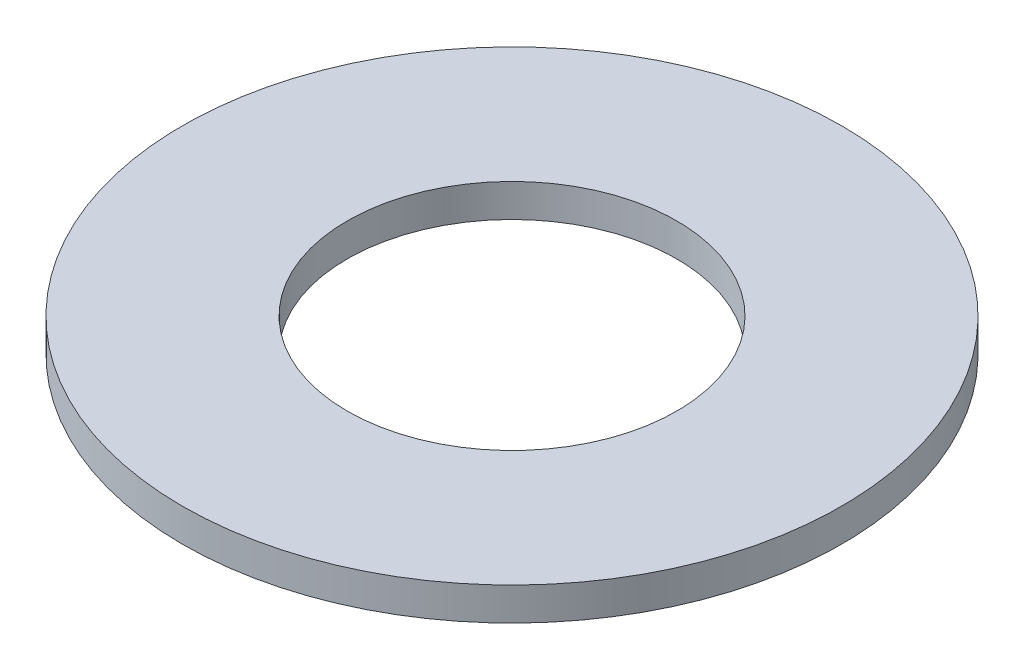
from build123d import *

# Parameters (mm, degrees)
SKETCH1_R           = 90
BOSS_EXTRUDE1_DEPTH = 9
SKETCH2_R           = 45
CUT_EXTRUDE1_DEPTH  = 128.597021909


with BuildPart() as part:
    # Sketch1 → Boss-Extrude1 (new body)
    with BuildSketch(Plane(origin=(0, 0, 0), x_dir=(1, 0, 0), z_dir=(0, 1, 0))):
        Circle(SKETCH1_R)
    extrude(amount=BOSS_EXTRUDE1_DEPTH)

    # Sketch2 → Cut-Extrude1 (cut, through all)
    with BuildSketch(Plane(origin=(0, 0, 0), x_dir=(1, 0, 0), z_dir=(0, 1, 0))):
        Circle(SKETCH2_R)
    extrude(amount=CUT_EXTRUDE1_DEPTH, mode=Mode.SUBTRACT)


solid = part.part
